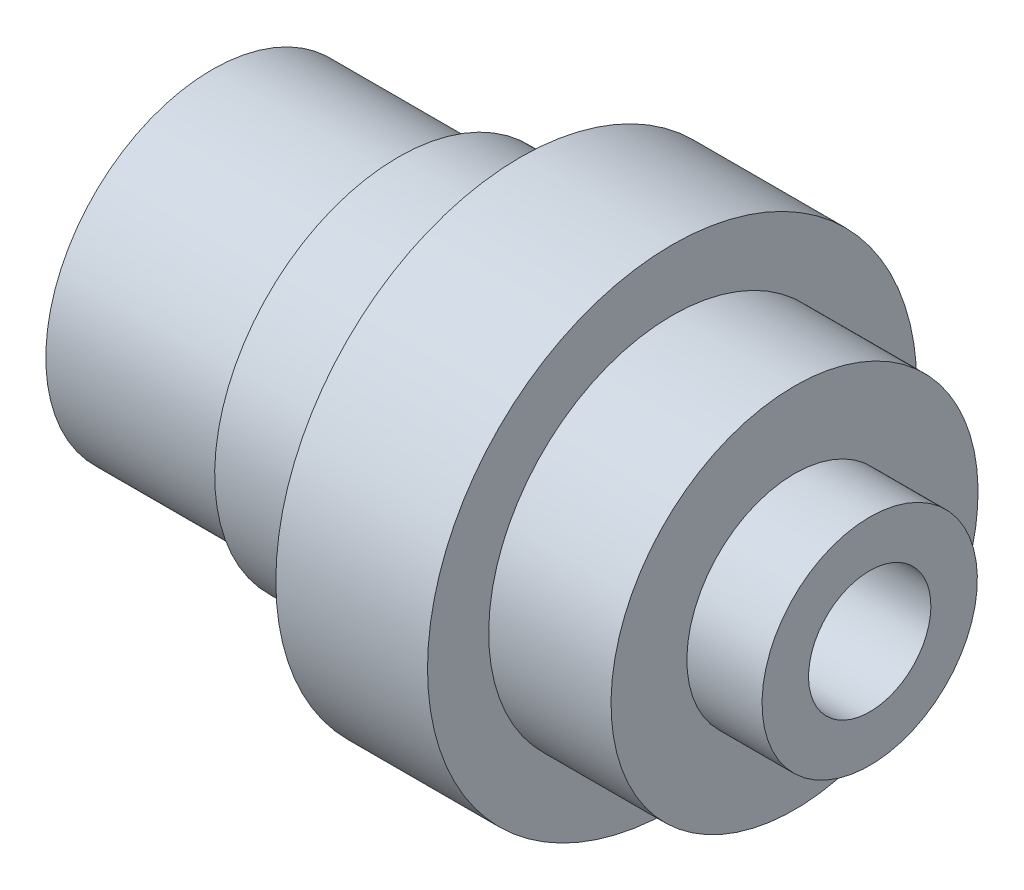
from build123d import *


with BuildPart() as part:
    # Sketch1 → Revolve1 (revolve)
    with BuildSketch(Plane.XY):
        Polygon((0, 8.636), (0, 3.175), (34.12744, 3.175), (34.12744, 5.588), (30.226, 5.588), (30.226, 9.525), (23.876, 9.525), (23.876, 12.7), (16.002, 12.7), (16.002, 9.525), (9.652, 9.525), (9.652, 8.636), align=None)
    revolve(axis=Axis((34.12744, 0, 0), (-1, 0, 0)))


solid = part.part
